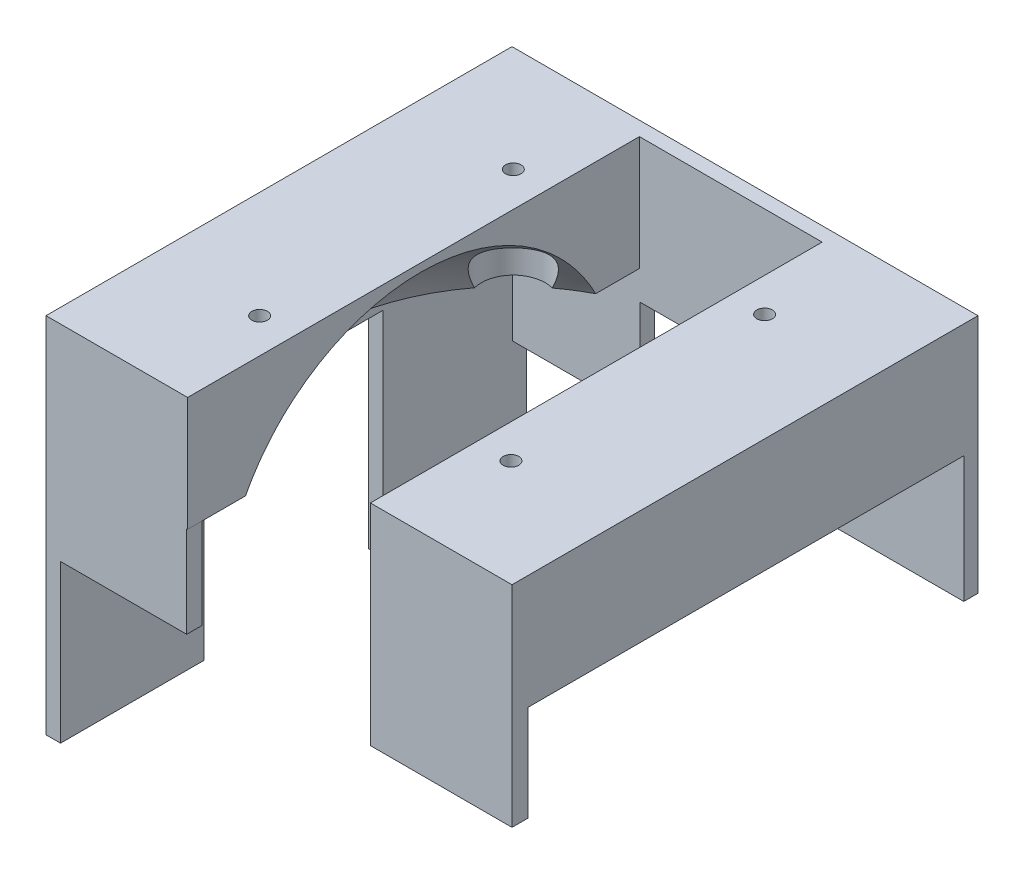
from build123d import *
from build123d.topology import SkipClean

# Parameters (mm, degrees)
SKETCH1_W                   = 102
SKETCH1_H                   = 102
BOSS_EXTRUDE1_DEPTH         = 50
CUT_EXTRUDE_THIN1_OUTLINE_W = 40
CUT_EXTRUDE_THIN1_OUTLINE_H = 95.773670058
CUT_EXTRUDE_THIN1_DEPTH     = 50
SKETCH4_W                   = 40
SKETCH4_H                   = 6.202657501
CUT_EXTRUDE3_DEPTH          = 54
SKETCH5_W                   = 33.817621941
SKETCH5_H                   = 102.594578927
CUT_EXTRUDE4_DEPTH          = 20
SKETCH6_W                   = 27.820383201
SKETCH6_H                   = 98.886835029
CUT_EXTRUDE5_DEPTH          = 20
SKETCH7_W                   = 30.8
SKETCH7_H                   = 3.364819678
BOSS_EXTRUDE2_DEPTH         = 21
SKETCH9_W                   = 31
SKETCH9_H                   = 3.479961613
BOSS_EXTRUDE4_DEPTH         = 21
SKETCH11_W                  = 98.820383201
SKETCH11_H                  = 3.113164971
BOSS_EXTRUDE6_DEPTH         = 47.625
SKETCH14_W                  = 102
SKETCH14_H                  = 5
CUT_EXTRUDE7_DEPTH          = 105
SKETCH17_R                  = 7
CUT_EXTRUDE12_DEPTH         = 20.5
M3_CLEARANCE_HOLE1_D        = 3.4
SKETCH22_W                  = 3.179616799
SKETCH22_H                  = 102
BOSS_EXTRUDE7_DEPTH         = 47.6
SKETCH23_W                  = 98.820383201
SKETCH23_H                  = 3.113164971
CUT_EXTRUDE13_DEPTH         = 40
SKETCH24_W                  = 102
SKETCH24_H                  = 13.144479163
CUT_EXTRUDE14_DEPTH         = 10
SKETCH25_W                  = 39.837829701
SKETCH25_H                  = 21.316982849
CUT_EXTRUDE15_DEPTH         = 6
SKETCH26_W                  = 39.22350869
SKETCH26_H                  = 46.778434415
CUT_EXTRUDE16_DEPTH         = 6


# Read off the part's stored shape, not the designer's step: Cut-Extrude-Thin1
with BuildPart() as part:
    # Sketch1 → Boss-Extrude1 (new body)
    with BuildSketch(Plane(origin=(0, 0, 0), x_dir=(1, 0, 0), z_dir=(0, 1, 0))):
        with Locations((-66.567363259, 25.977216604)):
            Rectangle(SKETCH1_W, SKETCH1_H)
    extrude(amount=BOSS_EXTRUDE1_DEPTH)

    # Sketch2 → Cut-Revolve1 (revolve, cut)
    with SkipClean():  # the faces are left unmerged after this step: merging them gives an invalid solid
        with BuildSketch(Plane(origin=(0, 0, 0), x_dir=(1, 0, 0), z_dir=(0, 1, 0))):
            with BuildLine():
                ThreePointArc((-66.567363259, 73.602216604), (-114.192363259, 25.977216604), (-66.567363259, -21.647783396))
                Line((-66.567363259, -21.647783396), (-66.567363259, 73.602216604))
            make_face()
            with BuildLine():
                Line((-66.567363259, 73.602216604), (-66.567363259, -21.647783396))
                ThreePointArc((-66.567363259, -21.647783396), (-32.891402805, -7.69874385), (-18.942363259, 25.977216604))
                ThreePointArc((-18.942363259, 25.977216604), (-32.891402805, 59.653177058), (-66.567363259, 73.602216604))
            make_face()
        revolve(axis=Axis((-66.567363259, 0, 21.647783396), (0, 0, -1)), mode=Mode.SUBTRACT)
    add(part.part.scale(1), mode=Mode.REPLACE)  # the faces are merged on a copy

    # Cut-Extrude-Thin1 outline → Cut-Extrude-Thin1 (cut)
    with BuildSketch(Plane(origin=(0, 0, 0), x_dir=(1, 0, 0), z_dir=(0, 1, 0))):
        with Locations((-66.567363259, 25.977216604)):
            Rectangle(CUT_EXTRUDE_THIN1_OUTLINE_W, CUT_EXTRUDE_THIN1_OUTLINE_H)
    extrude(amount=CUT_EXTRUDE_THIN1_DEPTH, mode=Mode.SUBTRACT)

    # Sketch4 → Cut-Extrude3 (cut)
    with BuildSketch(Plane(origin=(0, 0, 0), x_dir=(1, 0, 0), z_dir=(0, 1, 0))):
        with Locations((-66.567363259, -25.010947176)):
            Rectangle(SKETCH4_W, SKETCH4_H)
    extrude(amount=CUT_EXTRUDE3_DEPTH, mode=Mode.SUBTRACT)

    # Sketch5 → Cut-Extrude4 (cut)
    with BuildSketch(Plane(origin=(0, 0, 0), x_dir=(1, 0, 0), z_dir=(0, 1, 0))):
        with Locations((-29.658552289, 22.56676217)):
            Rectangle(SKETCH5_W, SKETCH5_H)
    extrude(amount=CUT_EXTRUDE4_DEPTH, mode=Mode.SUBTRACT)

    # Sketch6 → Cut-Extrude5 (cut)
    with BuildSketch(Plane(origin=(0, 0, 0), x_dir=(-1, 0, 0), z_dir=(0, -1, 0))):
        with Locations((100.47755486, 24.420634119)):
            Rectangle(SKETCH6_W, SKETCH6_H)
    extrude(amount=-CUT_EXTRUDE5_DEPTH, mode=Mode.SUBTRACT)

    # Sketch7 → Boss-Extrude2 (add)
    with BuildSketch(Plane(origin=(0, 0, 0), x_dir=(1, 0, 0), z_dir=(0, 1, 0))):
        with Locations((-102.167363259, -23.340373557)):
            Rectangle(SKETCH7_W, SKETCH7_H)
    extrude(amount=BOSS_EXTRUDE2_DEPTH)

    # Sketch9 → Boss-Extrude4 (add)
    with BuildSketch(Plane.XZ.offset(-20)):
        with Locations((-31.067363259, 23.28280259)):
            Rectangle(SKETCH9_W, SKETCH9_H)
    extrude(amount=BOSS_EXTRUDE4_DEPTH)

    # Sketch11 → Boss-Extrude6 (add)
    with BuildSketch(Plane.XZ):
        with Locations((-64.97755486, -75.420634119)):
            Rectangle(SKETCH11_W, SKETCH11_H)
    extrude(amount=BOSS_EXTRUDE6_DEPTH)

    # Sketch14 → Cut-Extrude7 (cut)
    with BuildSketch(Plane(origin=(-15.567363259, 0, 0), x_dir=(0, 0, -1), z_dir=(1, 0, 0))):
        with Locations((25.977216604, 47.5)):
            Rectangle(SKETCH14_W, SKETCH14_H)
    extrude(amount=-CUT_EXTRUDE7_DEPTH, mode=Mode.SUBTRACT)

    # Sketch17 → Cut-Extrude12 (cut)
    with BuildSketch(Plane.XZ.offset(-20)):
        with Locations(Location((-94.167363259, 1.657963718, 0), (0, 0, 270))):
            Circle(SKETCH17_R)
        with Locations(Location((-94.167363259, -53.864051633, 0), (0, 0, 284.685382437))):
            Circle(SKETCH17_R)
        with Locations(Location((-39.167363259, 1.657963718, 0), (0, 0, 349.246729183))):
            Circle(SKETCH17_R)
        with Locations(Location((-39.167363259, -53.864051633, 0), (0, 0, 270))):
            Circle(SKETCH17_R)
    extrude(amount=-CUT_EXTRUDE12_DEPTH, mode=Mode.SUBTRACT)

    # M3 Clearance Hole1 (through all)
    with Locations(Plane(origin=(0, 40.5, 0), x_dir=(-1, 0, 0), z_dir=(0, -1, 0))):
        with Locations((94.167363259, -1.657963718), (39.167363259, -1.657963718), (39.167363259, 53.864051633), (94.167363259, 53.864051633)):
            Hole(M3_CLEARANCE_HOLE1_D / 2)

    # Sketch22 → Boss-Extrude7 (add)
    with BuildSketch(Plane.XZ):
        with Locations((-115.97755486, -25.977216604)):
            Rectangle(SKETCH22_W, SKETCH22_H)
    extrude(amount=BOSS_EXTRUDE7_DEPTH)

    # Sketch23 → Cut-Extrude13 (cut)
    with BuildSketch(Plane.XZ.offset(47.625)):
        with Locations((-64.97755486, -75.420634119)):
            Rectangle(SKETCH23_W, SKETCH23_H)
    extrude(amount=-CUT_EXTRUDE13_DEPTH, mode=Mode.SUBTRACT)

    # Sketch24 → Cut-Extrude14 (cut)
    with BuildSketch(Plane(origin=(-114.38774646, 0, 0), x_dir=(0, 0, -1), z_dir=(1, 0, 0))):
        with Locations((25.977216604, -41.027760419)):
            Rectangle(SKETCH24_W, SKETCH24_H)
    extrude(amount=-CUT_EXTRUDE14_DEPTH, mode=Mode.SUBTRACT)

    # Sketch25 → Cut-Extrude15 (cut)
    with BuildSketch(Plane.XY.offset(-73.864051633)):
        with Locations((-66.48627811, 3.033491424)):
            Rectangle(SKETCH25_W, SKETCH25_H)
    extrude(amount=-CUT_EXTRUDE15_DEPTH, mode=Mode.SUBTRACT)

    # Sketch26 → Cut-Extrude16 (cut)
    with BuildSketch(Plane(origin=(-114.38774646, 0, 0), x_dir=(0, 0, -1), z_dir=(1, 0, 0))):
        with Locations((25.942998987, -11.06630363)):
            Rectangle(SKETCH26_W, SKETCH26_H)
    extrude(amount=-CUT_EXTRUDE16_DEPTH, mode=Mode.SUBTRACT)


solid = part.part
